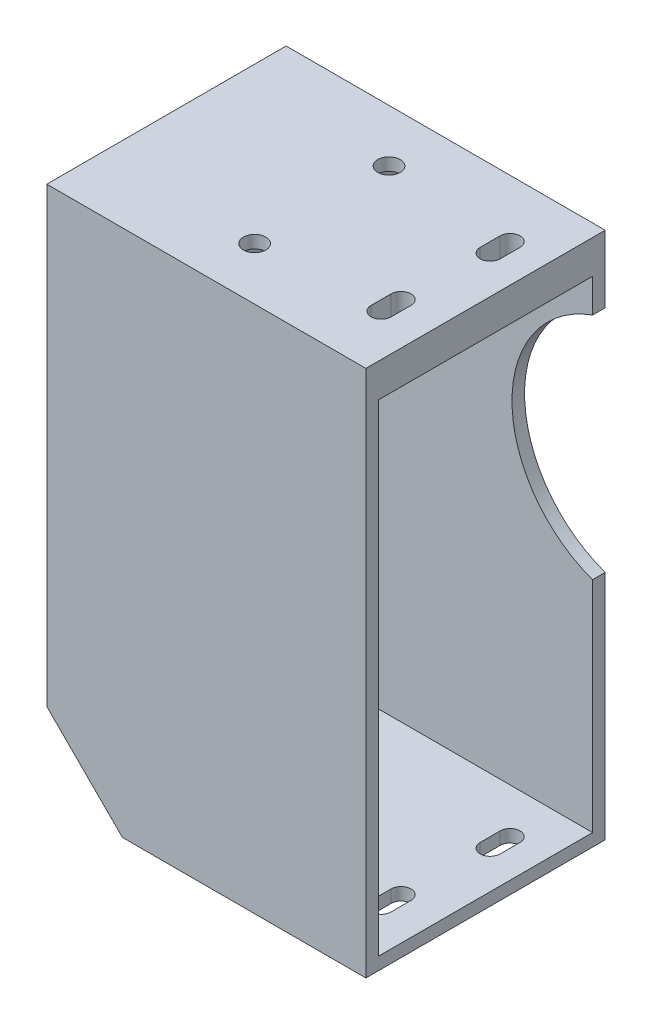
from build123d import *

# Parameters (mm, degrees)
SKETCH2_W           = 57
SKETCH2_H           = 120.75
SKETCH2_W_2         = 51
SKETCH2_H_2         = 114.75
BOSS_EXTRUDE1_DEPTH = 75
SKETCH3_W           = 57
SKETCH3_H           = 120.75
BOSS_EXTRUDE2_DEPTH = 3
SKETCH4_W           = 78
SKETCH4_H           = 57
BOSS_EXTRUDE3_DEPTH = 5
SKETCH6_R           = 2.675
CUT_EXTRUDE2_DEPTH  = 10
CUT_EXTRUDE3_DEPTH  = 138.287528874
BOSS_EXTRUDE4_REACH = 139.288
CUT_EXTRUDE7_DEPTH  = 150.745739841
BOSS_EXTRUDE8_DEPTH = 5
SKETCH21_R          = 3
CUT_EXTRUDE11_DEPTH = 1094
CHAMFER2_SIZE       = 2
CHAMFER2_SIZE2      = 6.751886845
SKETCH22_R          = 1.675
CUT_EXTRUDE12_DEPTH = 1094
CUT_EXTRUDE13_DEPTH = 5
SKETCH25_R          = 5.125
CUT_EXTRUDE14_DEPTH = 131.551099899
CHAMFER3_SIZE       = 2
FILLET1_R           = 2
SKETCH27_R          = 3
CUT_EXTRUDE15_DEPTH = 3
CUT_EXTRUDE16_DEPTH = 10


with BuildPart() as part:
    # Sketch2 → Boss-Extrude1 (new body)
    with BuildSketch(Plane(origin=(0, 0, 0), x_dir=(0, 0, -1), z_dir=(1, 0, 0))):
        with Locations((2.896243414, -39.494242434)):
            Rectangle(SKETCH2_W, SKETCH2_H)
        with Locations((2.896243414, -39.494242434)):
            Rectangle(SKETCH2_W_2, SKETCH2_H_2, mode=Mode.SUBTRACT)
    extrude(amount=BOSS_EXTRUDE1_DEPTH)

    # Sketch3 → Boss-Extrude2 (add)
    with BuildSketch(Plane.ZY):
        with Locations((-2.896243414, -39.494242434)):
            Rectangle(SKETCH3_W, SKETCH3_H)
    extrude(amount=BOSS_EXTRUDE2_DEPTH)

    # Sketch4 → Boss-Extrude3 (add)
    with BuildSketch(Plane(origin=(0, 20.880757566, 0), x_dir=(1, 0, 0), z_dir=(0, 1, 0))):
        with Locations((36, 2.896243414)):
            Rectangle(SKETCH4_W, SKETCH4_H)
    extrude(amount=BOSS_EXTRUDE3_DEPTH)

    # Sketch6 → Cut-Extrude2 (cut)
    with BuildSketch(Plane(origin=(0, 25.880757566, 0), x_dir=(1, 0, 0), z_dir=(0, 1, 0))):
        with Locations(Location((36, 18.896243414, 0), (0, 0, 270))):
            Circle(SKETCH6_R)
        with Locations(Location((36, -13.103756586, 0), (0, 0, 90))):
            Circle(SKETCH6_R)
    extrude(amount=-CUT_EXTRUDE2_DEPTH, mode=Mode.SUBTRACT)

    # Sketch8 → Cut-Extrude3 (cut, through all)
    with BuildSketch(Plane(origin=(0, 0, -31.396243414), x_dir=(-1, 0, 0), z_dir=(0, 0, -1))):
        Polygon((3, -99.869242434), (3, -79.869242434), (-17, -99.869242434), align=None)
    extrude(amount=-CUT_EXTRUDE3_DEPTH, mode=Mode.SUBTRACT)

    # Sketch9 → Boss-Extrude4 (add, up to next)
    with BuildSketch(Plane.XY.offset(25.603756586), mode=Mode.PRIVATE) as boss_extrude4_sk1:
        Polygon((-3, -79.869242434), (17, -99.869242434), (21.242640687, -99.869242434), (-3, -75.626601747), align=None)
    boss_extrude4_tool1 = extrude(boss_extrude4_sk1.sketch, amount=-BOSS_EXTRUDE4_REACH, mode=Mode.PRIVATE) - part.part
    add(boss_extrude4_tool1.solids().sort_by_distance((8.094564, -88.774678, 25.603757))[0])

    # Sketch15 → Cut-Extrude7 (cut, through all)
    with BuildSketch(Plane.XZ.offset(99.869242434)):
        with BuildLine():
            Line((62.625, 7.228756586), (62.625, 11.978756586))
            ThreePointArc((62.625, 11.978756586), (65, 14.353756586), (67.375, 11.978756586))
            Line((67.375, 11.978756586), (67.375, 7.228756586))
            ThreePointArc((67.375, 7.228756586), (65, 4.853756586), (62.625, 7.228756586))
        make_face()
        with BuildLine():
            Line((63.643986667, -17.72757696), (63.643986667, -12.97757696))
            ThreePointArc((63.643986667, -12.97757696), (66.018986667, -10.60257696), (68.393986667, -12.97757696))
            Line((68.393986667, -12.97757696), (68.393986667, -17.72757696))
            ThreePointArc((68.393986667, -17.72757696), (66.018986667, -20.10257696), (63.643986667, -17.72757696))
        make_face()
    extrude(amount=-CUT_EXTRUDE7_DEPTH, mode=Mode.SUBTRACT)

    # Sketch20 → Boss-Extrude8 (add)
    with BuildSketch(Plane(origin=(0, 0, 0), x_dir=(0, 0, -1), z_dir=(1, 0, 0))):
        with BuildLine():
            Line((-9.103756586, 5.880757566), (-9.103756586, 17.880757566))
            Line((-9.103756586, 17.880757566), (14.896243414, 17.880757566))
            Line((14.896243414, 17.880757566), (14.896243414, 5.880757566))
            ThreePointArc((14.896243414, 5.880757566), (2.896243414, -6.119242434), (-9.103756586, 5.880757566))
        make_face()
    extrude(amount=BOSS_EXTRUDE8_DEPTH)

    # Sketch21 → Cut-Extrude11 (cut)
    with BuildSketch(Plane(origin=(5, 0, 0), x_dir=(0, 0, -1), z_dir=(1, 0, 0))):
        with Locations((2.896243414, 5.937348)):
            Circle(SKETCH21_R)
    extrude(amount=-CUT_EXTRUDE11_DEPTH, mode=Mode.SUBTRACT)

    # Chamfer2
    chamfer2_edges = [part.edges().sort_by_distance(p)[0] for p in [
        (5, 5.937348, 0.103756586),
    ]]
    chamfer2_side = [part.faces().sort_by_distance(p)[0] for p in [
        (5, 11.880757566, 8.764345331),
    ]]
    chamfer(chamfer2_edges, length=CHAMFER2_SIZE, length2=CHAMFER2_SIZE2, reference=chamfer2_side[0])

    # Sketch22 → Cut-Extrude12 (cut)
    with BuildSketch(Plane(origin=(5, 0, 0), x_dir=(0, 0, -1), z_dir=(1, 0, 0))):
        with Locations((-5.603756586, 5.880757566)):
            Circle(SKETCH22_R)
        with Locations((11.396243414, 5.880757566)):
            Circle(SKETCH22_R)
    extrude(amount=-CUT_EXTRUDE12_DEPTH, mode=Mode.SUBTRACT)

    # Sketch24 → Cut-Extrude13 (cut)
    with BuildSketch(Plane.XZ.offset(-17.880757566)):
        Polygon((40.820874748, -18.896243414), (38.410437374, -14.721243414), (33.589562626, -14.721243414), (31.179125252, -18.896243414), (33.589562626, -23.071243414), (38.410437374, -23.071243414), align=None)
        Polygon((38.410437374, 17.278756586), (40.820874748, 13.103756586), (38.410437374, 8.928756586), (33.589562626, 8.928756586), (31.179125252, 13.103756586), (33.589562626, 17.278756586), align=None)
    extrude(amount=-CUT_EXTRUDE13_DEPTH, mode=Mode.SUBTRACT)

    # Sketch25 → Cut-Extrude14 (cut, through all)
    with BuildSketch(Plane.ZY.offset(3)):
        with Locations((-2.896243414, -26.994242434)):
            Circle(SKETCH25_R)
    extrude(amount=-CUT_EXTRUDE14_DEPTH, mode=Mode.SUBTRACT)

    # Chamfer3
    chamfer3_edges = [part.edges().sort_by_distance(p)[0] for p in [
        (-3, -26.994242434, -31.396243414),
        (-3, 25.880757566, -2.896243414),
        (-3, -26.994242434, 25.603756586),
    ]]
    chamfer(chamfer3_edges, length=CHAMFER3_SIZE)

    # Fillet1
    # the kernel refuses this fillet: 2 mm, written as the material it takes off along each edge
    with BuildSketch(Plane(origin=(-3, 5.937348, -2.896243414), x_dir=(0, 0, -1), z_dir=(0, -1, 0))) as fillet1_piece_1:
        with BuildLine():
            CenterArc((4.853285238, 2), FILLET1_R, 202.082634117, 67.917365883)
            Line((3, 1.248113155), (2.962934295, 1.233075418))
            ThreePointArc((2.962934295, 1.233075418), (2.96, 0.624056577), (2.96, 0))
            Line((2.96, 0), (3, -0.04))
            Line((3, -0.04), (4.853285238, -0.04))
            Line((4.853285238, -0.04), (4.853285238, 0))
        make_face()
    revolve(axis=Axis((-3, 5.937348, -2.896243414), (1, 0, 0)), mode=Mode.SUBTRACT)

    # Sketch27 → Cut-Extrude15 (cut)
    with BuildSketch(Plane.ZY.offset(3)):
        with Locations((-11.396243414, 5.880757566)):
            Circle(SKETCH27_R)
        with Locations((5.603756586, 5.880757566)):
            Circle(SKETCH27_R)
    extrude(amount=-CUT_EXTRUDE15_DEPTH, mode=Mode.SUBTRACT)

    # Sketch28 → Cut-Extrude16 (cut)
    with BuildSketch(Plane(origin=(0, 0, -31.396243414), x_dir=(-1, 0, 0), z_dir=(0, 0, -1))):
        with BuildLine():
            Line((-75, 9.880757566), (-75, -44.707153183))
            ThreePointArc((-75, -44.707153183), (-55.8, -17.413197809), (-75, 9.880757566))
        make_face()
    extrude(amount=-CUT_EXTRUDE16_DEPTH, mode=Mode.SUBTRACT)


solid = part.part
